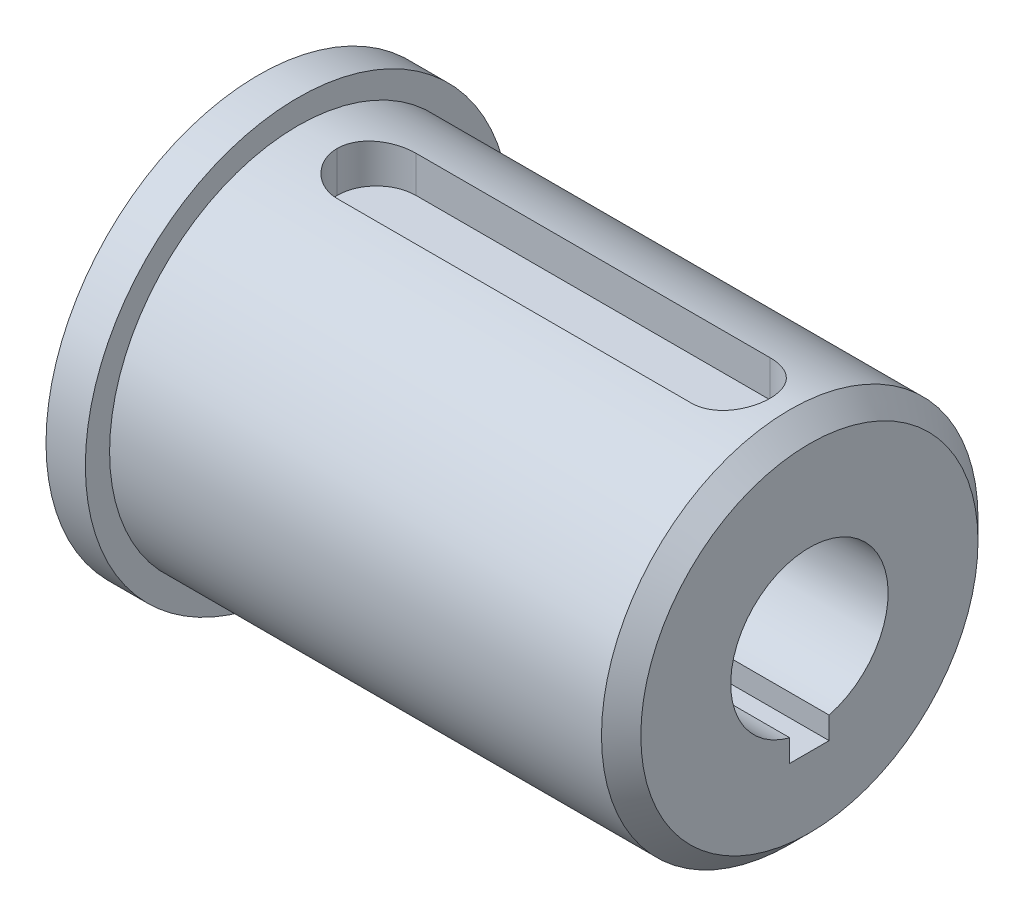
from build123d import *

# Parameters (mm, degrees)
SKETCH1_R           = 15.1892
SKETCH1_R_2         = 6.35
BOSS_EXTRUDE1_DEPTH = 41.275
SKETCH2_W           = 3.175
SKETCH2_H           = 3.175
SKETCH2_W_2         = 6.35
SKETCH2_H_2         = 6.35
CUT_EXTRUDE1_DEPTH  = 47.530089
BOSS_EXTRUDE2_START = 3.175
SKETCH3_R           = 17.145
BOSS_EXTRUDE2_DEPTH = 3.175
BOSS_EXTRUDE3_DEPTH = 3.175
BOSS_EXTRUDE4_START = -3.175
SKETCH5_R           = 15.1892
SKETCH5_R_2         = 10.967899
BOSS_EXTRUDE4_DEPTH = 3.175
FILLET1_R           = 3.175
CHAMFER1_SIZE       = 1.5875


with BuildPart() as part:
    # Sketch1 → Boss-Extrude1 (new body)
    with BuildSketch(Plane(origin=(0, 0, 0), x_dir=(0, 0, -1), z_dir=(1, 0, 0))):
        Circle(SKETCH1_R)
        Circle(SKETCH1_R_2, mode=Mode.SUBTRACT)
    extrude(amount=BOSS_EXTRUDE1_DEPTH)

    # Sketch2 → Cut-Extrude1 (cut, through all)
    with BuildSketch(Plane(origin=(41.275, 0, 0), x_dir=(0, 0, -1), z_dir=(1, 0, 0))):
        with Locations((0, -6.35)):
            Rectangle(SKETCH2_W, SKETCH2_H)
        with Locations((0, 15.08125)):
            Rectangle(SKETCH2_W_2, SKETCH2_H_2)
    extrude(amount=-CUT_EXTRUDE1_DEPTH, mode=Mode.SUBTRACT)

    # Sketch3 → Boss-Extrude2 (add)
    # profile 1 of 2: a face of its own
    with BuildSketch(Plane.ZY.offset(BOSS_EXTRUDE2_START)):
        Circle(SKETCH3_R)
        with BuildLine():
            Line((-3.175, 11.90625), (3.175, 11.90625))
            Line((3.175, 11.90625), (3.175, 14.853659))
            ThreePointArc((3.175, 14.853659), (0, -15.1892), (-3.175, 14.853659))
            Line((-3.175, 14.853659), (-3.175, 11.90625))
        make_face(mode=Mode.SUBTRACT)
    # profile 2 of 2: a face of its own
    with BuildSketch(Plane.ZY.offset(BOSS_EXTRUDE2_START)):
        with BuildLine():
            Line((3.175, 14.853659), (3.175, 11.90625))
            Line((3.175, 11.90625), (-3.175, 11.90625))
            Line((-3.175, 11.90625), (-3.175, 14.853659))
            ThreePointArc((-3.175, 14.853659), (0, -15.1892), (3.175, 14.853659))
        make_face()
        with BuildLine():
            Line((-1.5875, -7.9375), (-1.5875, -6.148361))
            ThreePointArc((-1.5875, -6.148361), (0, 6.35), (1.5875, -6.148361))
            Line((1.5875, -6.148361), (1.5875, -7.9375))
            Line((1.5875, -7.9375), (-1.5875, -7.9375))
        make_face(mode=Mode.SUBTRACT)
    extrude(amount=-BOSS_EXTRUDE2_DEPTH)

    # Sketch4 → Boss-Extrude3 (add)
    with BuildSketch(Plane(origin=(0, 0, 0), x_dir=(0, 0, -1), z_dir=(1, 0, 0))):
        with BuildLine():
            ThreePointArc((3.175, 14.853659), (0, 15.1892), (-3.175, 14.853659))
            Line((-3.175, 14.853659), (-3.175, 11.90625))
            Line((-3.175, 11.90625), (3.175, 11.90625))
            Line((3.175, 11.90625), (3.175, 14.827684))
            Line((3.175, 14.827684), (3.175, 14.853659))
        make_face()
    extrude(amount=BOSS_EXTRUDE3_DEPTH)

    # Sketch5 → Boss-Extrude4 (add)
    with BuildSketch(Plane(origin=(41.275, 0, 0), x_dir=(0, 0, -1), z_dir=(1, 0, 0)).offset(BOSS_EXTRUDE4_START)):
        Circle(SKETCH5_R)
        Circle(SKETCH5_R_2, mode=Mode.SUBTRACT)
    extrude(amount=BOSS_EXTRUDE4_DEPTH)

    # Fillet1
    # the kernel refuses this fillet: 3.175 mm, written as the material it adds along each edge
    with BuildSketch(Plane(origin=(3.175, 22.791159, -3.175), x_dir=(1, 0, 0), z_dir=(0, -1, 0))) as fillet1_piece_1_section:
        with BuildLine():
            CenterArc((FILLET1_R, FILLET1_R), FILLET1_R, 180, 90)
            Line((0, FILLET1_R), (0, 0))
            Line((0, 0), (FILLET1_R, 0))
        make_face()
    fillet1_piece_1 = extrude(amount=10.884909, mode=Mode.PRIVATE)
    fillet1_piece_1 = fillet1_piece_1 & Plane(origin=(3.873842, 0, 0), x_dir=(0, 0, -1), z_dir=(-1, 0, 0)) * Cylinder(15.1892, 35, mode=Mode.PRIVATE)
    add(fillet1_piece_1)
    with BuildSketch(Plane(origin=(3.175, 22.791159, 3.175), x_dir=(1, 0, 0), z_dir=(0, -1, 0))) as fillet1_piece_2_section:
        with BuildLine():
            CenterArc((FILLET1_R, -FILLET1_R), FILLET1_R, 90, 90)
            Line((0, -FILLET1_R), (0, 0))
            Line((0, 0), (FILLET1_R, 0))
        make_face()
    fillet1_piece_2 = extrude(amount=10.884909, mode=Mode.PRIVATE)
    fillet1_piece_2 = fillet1_piece_2 & Plane(origin=(3.873846, 0, 0), x_dir=(0, 0, -1), z_dir=(-1, 0, 0)) * Cylinder(15.1892, 35, mode=Mode.PRIVATE)
    add(fillet1_piece_2)
    with BuildSketch(Plane(origin=(38.1, 11.90625, 3.175), x_dir=(0, 0, -1), z_dir=(0, 1, 0))) as fillet1_piece_3_section:
        with BuildLine():
            CenterArc((FILLET1_R, FILLET1_R), FILLET1_R, 180, 90)
            Line((0, FILLET1_R), (0, 0))
            Line((0, 0), (FILLET1_R, 0))
        make_face()
    fillet1_piece_3 = extrude(amount=10.884909, mode=Mode.PRIVATE)
    fillet1_piece_3 = fillet1_piece_3 & Plane(origin=(37.401164, 0, 0), x_dir=(0, 0, -1), z_dir=(-1, 0, 0)) * Cylinder(15.1892, 35, mode=Mode.PRIVATE)
    add(fillet1_piece_3)
    with BuildSketch(Plane(origin=(38.1, 22.791159, -3.175), x_dir=(-1, 0, 0), z_dir=(0, -1, 0))) as fillet1_piece_4_section:
        with BuildLine():
            CenterArc((FILLET1_R, -FILLET1_R), FILLET1_R, 90, 90)
            Line((0, -FILLET1_R), (0, 0))
            Line((0, 0), (FILLET1_R, 0))
        make_face()
    fillet1_piece_4 = extrude(amount=10.884909, mode=Mode.PRIVATE)
    fillet1_piece_4 = fillet1_piece_4 & Plane(origin=(37.401158, 0, 0), x_dir=(0, 0, -1), z_dir=(-1, 0, 0)) * Cylinder(15.1892, 35, mode=Mode.PRIVATE)
    add(fillet1_piece_4)

    # Chamfer1
    chamfer1_edges = [part.edges().sort_by_distance(p)[0] for p in [
        (41.275, -14.853659, 3.175),
    ]]
    chamfer(chamfer1_edges, length=CHAMFER1_SIZE)


solid = part.part
